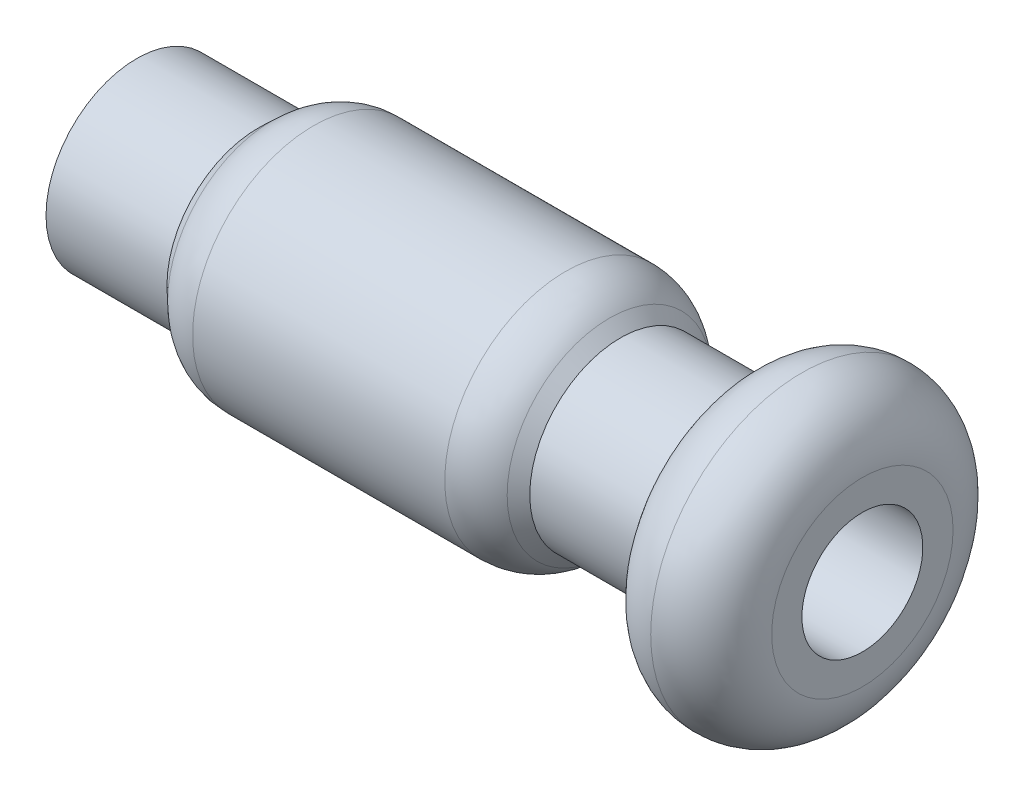
from build123d import *

# Parameters (mm, degrees)
SKETCH2_W = 2
SKETCH2_H = 1.5
FILLET1_R = 1
FILLET2_R = 1


with BuildPart() as part:
    # Sketch1 → Revolve1 (revolve)
    with BuildSketch(Plane.XY, mode=Mode.PRIVATE) as revolve1_sk:
        Polygon((0, 0), (10, 0), (10, 0.5), (8, 0.5), (7.521875, 1), (2.522875817, 1), (2, 0.5), (0, 0.5), align=None)
    revolve(revolve1_sk.sketch.rotate(Axis((-1.430896147, -1, 0), (1, 0, 0)), 90), axis=Axis((-1.430896147, -1, 0), (1, 0, 0)))

    # Sketch2 → Revolve2 (revolve)
    with BuildSketch(Plane.XY, mode=Mode.PRIVATE) as revolve2_sk:
        with Locations((11, -2.75)):
            Rectangle(SKETCH2_W, SKETCH2_H)
    revolve(revolve2_sk.sketch.rotate(Axis((10, -1, 0), (1, 0, 0)), 270), axis=Axis((10, -1, 0), (1, 0, 0)))

    # Fillet1
    fillet1_edges = [part.edges().sort_by_distance(p)[0] for p in [
        (2.522875817, -1, -2),
        (7.521875, -1, -2),
    ]]
    fillet(fillet1_edges, radius=FILLET1_R)

    # Fillet2
    fillet2_edges = [part.edges().sort_by_distance(p)[0] for p in [
        (12, -1, -2.5),
        (10, -1, -2.5),
    ]]
    fillet(fillet2_edges, radius=FILLET2_R - 0.0001)  # a hair under: the kernel refuses the full size


solid = part.part
